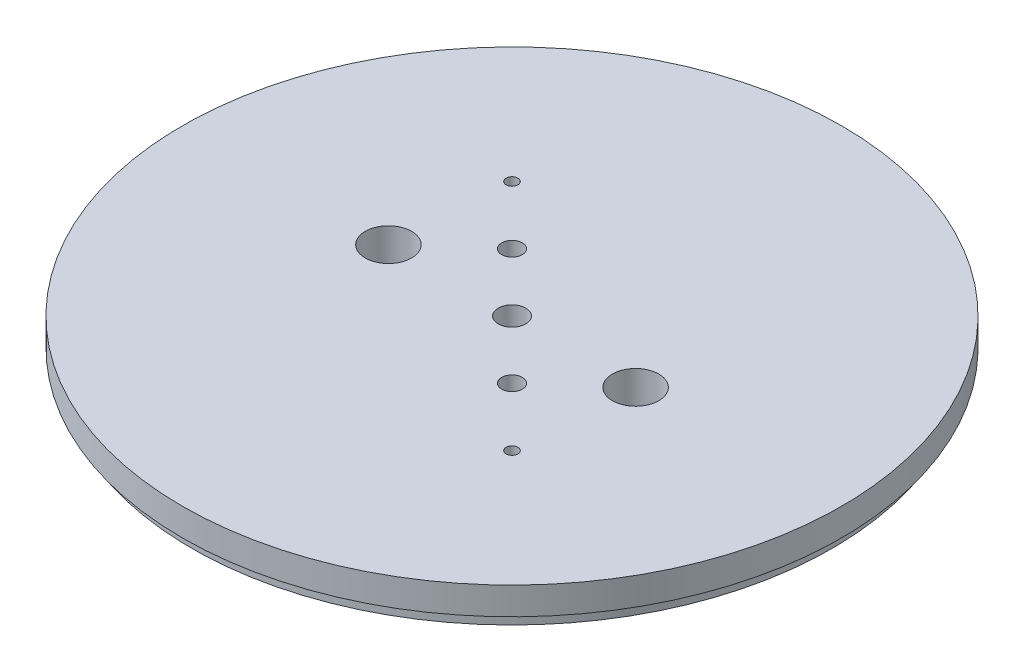
from build123d import *

# Parameters (mm, degrees)
SKETCH1_R           = 76.2
SKETCH1_R_2         = 3.175
SKETCH1_R_3         = 5.3578125
SKETCH1_R_4         = 1.3589
SKETCH1_R_5         = 2.38125
BOSS_EXTRUDE1_DEPTH = 9.525
SKETCH2_R           = 76.2
SKETCH2_R_2         = 74.041
CUT_EXTRUDE1_DEPTH  = 3.175
CUT_EXTRUDE2_START  = -5.969
CUT_EXTRUDE2_DEPTH  = 3.556


with BuildPart() as part:
    # Sketch1 → Boss-Extrude1 (new body)
    with BuildSketch(Plane(origin=(0, 0, 0), x_dir=(1, 0, 0), z_dir=(0, 1, 0))):
        Circle(SKETCH1_R)
        Circle(SKETCH1_R_2, mode=Mode.SUBTRACT)
        with Locations((28.575, 0)):
            Circle(SKETCH1_R_3, mode=Mode.SUBTRACT)
        with Locations((-28.575, 0)):
            Circle(SKETCH1_R_3, mode=Mode.SUBTRACT)
        with Locations((-26.940768363, 26.940768363)):
            Circle(SKETCH1_R_4, mode=Mode.SUBTRACT)
        with Locations((26.940768363, -26.940768363)):
            Circle(SKETCH1_R_4, mode=Mode.SUBTRACT)
        with Locations((-13.470384182, 13.470384182)):
            Circle(SKETCH1_R_5, mode=Mode.SUBTRACT)
        with Locations((13.470384182, -13.470384182)):
            Circle(SKETCH1_R_5, mode=Mode.SUBTRACT)
    extrude(amount=BOSS_EXTRUDE1_DEPTH)

    # Sketch2 → Cut-Extrude1 (cut)
    with BuildSketch(Plane.XZ):
        Circle(SKETCH2_R)
        Circle(SKETCH2_R_2, mode=Mode.SUBTRACT)
    extrude(amount=-CUT_EXTRUDE1_DEPTH, mode=Mode.SUBTRACT)

    # Sketch3 → Cut-Extrude2 (cut)
    with BuildSketch(Plane(origin=(0, 9.525, 0), x_dir=(1, 0, 0), z_dir=(0, 1, 0)).offset(CUT_EXTRUDE2_START)):
        with BuildLine():
            Line((3.2385, 34.798), (3.2385, 13.97))
            ThreePointArc((3.2385, 13.97), (0, 10.7315), (-3.2385, 13.97))
            Line((-3.2385, 13.97), (-3.2385, 34.798))
            ThreePointArc((-3.2385, 34.798), (0, 38.0365), (3.2385, 34.798))
        make_face()
        with BuildLine():
            Line((3.2385, -34.798), (3.2385, -13.97))
            ThreePointArc((3.2385, -13.97), (0, -10.7315), (-3.2385, -13.97))
            Line((-3.2385, -13.97), (-3.2385, -34.798))
            ThreePointArc((-3.2385, -34.798), (0, -38.0365), (3.2385, -34.798))
        make_face()
    extrude(amount=-CUT_EXTRUDE2_DEPTH, mode=Mode.SUBTRACT)


solid = part.part
